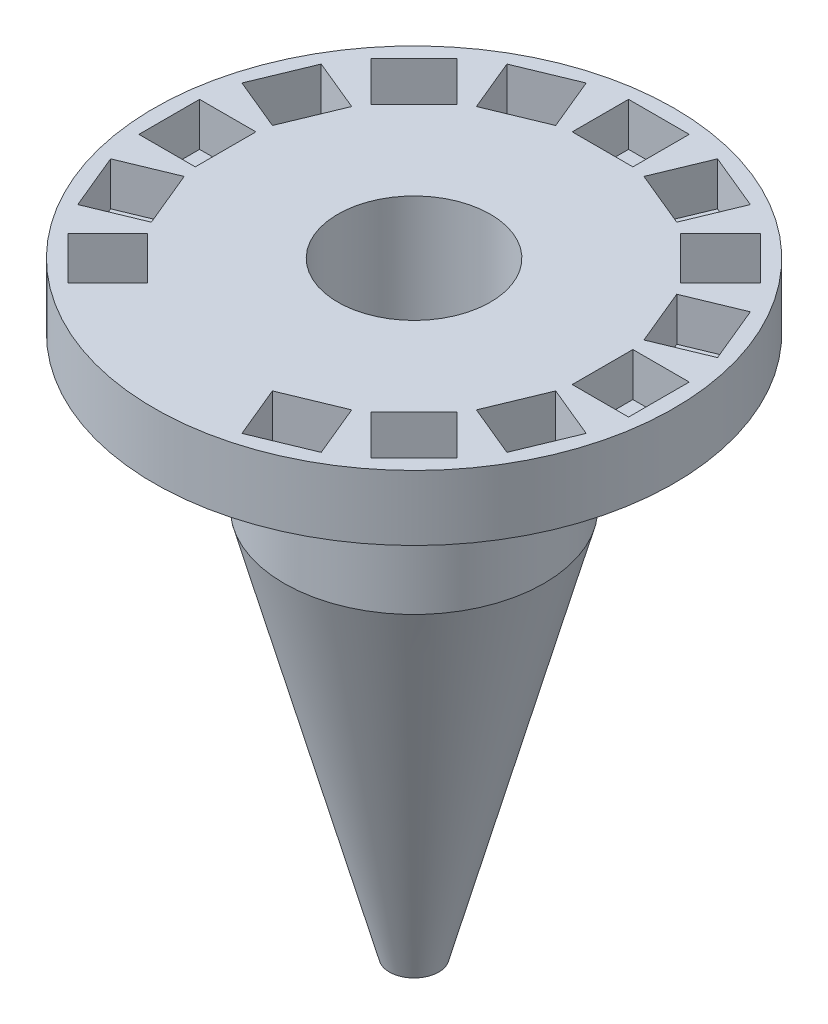
from build123d import *

# Parameters (mm, degrees)
SKETCH2_W          = 1.4
SKETCH2_H          = 1.3
CUT_EXTRUDE1_DEPTH = 1
CIRPATTERN1_COUNT  = 16


with BuildPart() as part:
    # Sketch1 → Revolve1 (revolve)
    with BuildSketch(Plane(origin=(0, 0, 0), x_dir=(0, 0, -1), z_dir=(1, 0, 0))):
        Polygon((1.76, 2.5), (6, 2.5), (6, 1), (3, 1), (3, -2.5), (0.570548961, -11.482894875), (0.295700194, -11.482894875), (1.76, -2.5), align=None)
    revolve(axis=Axis((0, 0, 0), (0, 1, 0)))

    # Sketch2 → Cut-Extrude1 (cut)
    with BuildSketch(Plane(origin=(0, 2.5, 0), x_dir=(1, 0, 0), z_dir=(0, 1, 0))):
        with Locations((0, 5)):
            Rectangle(SKETCH2_W, SKETCH2_H)
    cut_extrude1 = extrude(amount=-CUT_EXTRUDE1_DEPTH, mode=Mode.SUBTRACT)

    # CirPattern1: Cut-Extrude1 ×16 about axis, 2 skipped
    cirpattern1_axis = Axis((0, 0, 0), (0, -1, 0))
    add([cut_extrude1.rotate(cirpattern1_axis, i * 360 / CIRPATTERN1_COUNT) for i in range(1, CIRPATTERN1_COUNT) if i not in (8, 9)], mode=Mode.SUBTRACT)


solid = part.part
